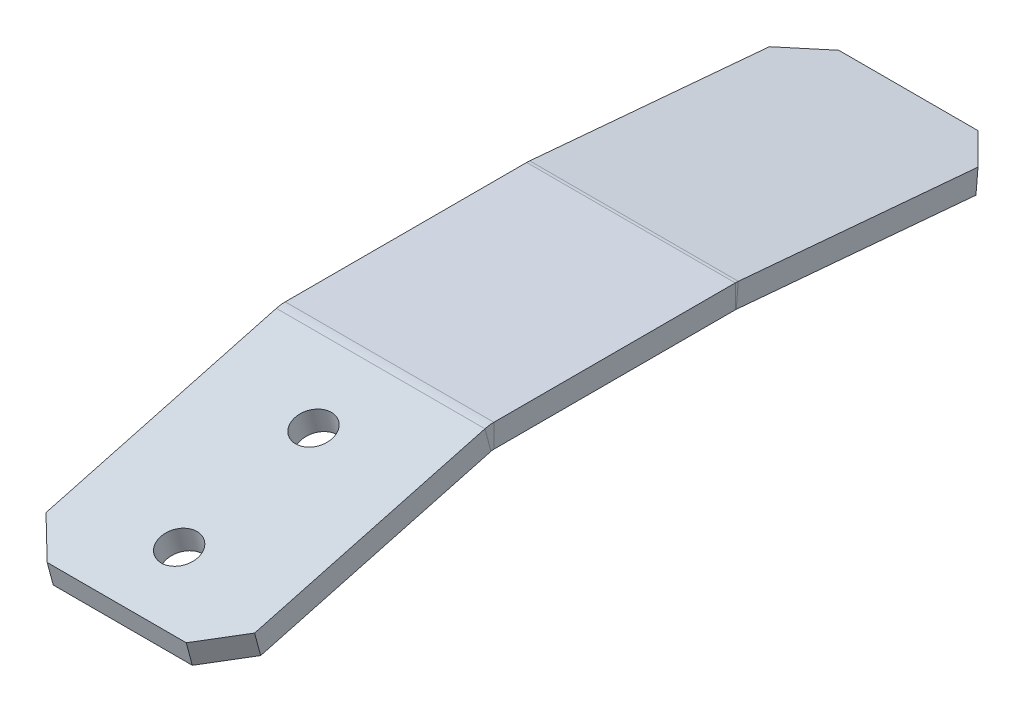
from build123d import *

# Parameters (mm, degrees)
SKETCH1_W                        = 38.1
SKETCH1_H                        = 44.45
BASE_FLANGE1_DEPTH               = 4.2672
EDGE_FLANGE1_STRIP_CUT_DEPTH     = 38.1
EDGE_FLANGE1_DEPTH               = 38.1
EDGE_FLANGE2_STRIP_CUT_DEPTH     = 38.1
EDGE_FLANGE2_DEPTH               = 38.1
CHAMFER1_SIZE                    = 6.35
F_17_64_0_26563_DIAMETER_HOLE1_D = 6.747002


# Sheet-metal steps are written as plain solids
with BuildPart() as part:
    # Sketch1 → Base-Flange1 (new body)
    with BuildSketch(Plane(origin=(0, 0, 0), x_dir=(1, 0, 0), z_dir=(0, 1, 0))):
        Rectangle(SKETCH1_W, SKETCH1_H)
    extrude(amount=-BASE_FLANGE1_DEPTH)

    # Edge-Flange1 strip (across the edge) → Edge-Flange1 strip cut (cut)
    with BuildSketch(Plane(origin=(19.05, -4.2672, 22.225), x_dir=(0, -0.96592582628907, -0.2588190451025146), z_dir=(-1, 0, 0))):
        Polygon((-9.522131081, 19.049882248), (-4.052559965, -1.362835054), (0.069238721, -0.258402425), (-5.400332395, 20.154314877), align=None)
    extrude(amount=EDGE_FLANGE1_STRIP_CUT_DEPTH, mode=Mode.SUBTRACT)

    # Edge-Flange1 section (across the edge) → Edge-Flange1 (add)
    with BuildSketch(Plane(origin=(19.05, -4.2672, 22.225), x_dir=(0, -0.96592582628907, -0.2588190451025146), z_dir=(-1, 0, 0))):
        with BuildLine():
            Line((-4.2672, 0.267517875), (-4.2672, 50.17300498))
            Line((-4.2672, 50.17300498), (0, 50.17300498))
            Line((0, 50.17300498), (0, 0.267517875))
            ThreePointArc((0, 0.267517875), (0.017384042, 0.002288653), (0.069238721, -0.258402425))
            Line((0.069238721, -0.258402425), (-4.052559965, -1.362835054))
            ThreePointArc((-4.052559965, -1.362835054), (-4.213309471, -0.554692715), (-4.2672, 0.267517875))
        make_face()
    extrude(amount=EDGE_FLANGE1_DEPTH)

    # Edge-Flange2 strip (across the edge) → Edge-Flange2 strip cut (cut)
    with BuildSketch(Plane(origin=(-19.05, -4.2672, -22.225), x_dir=(0, -0.9961946980917461, 0.08715574274765156), z_dir=(1, 0, 0))):
        Polygon((-6.085074523, 20.592090897), (-4.243229642, -0.460292419), (0.007732373, -0.088381433), (-1.834112507, 20.964001883), align=None)
    extrude(amount=EDGE_FLANGE2_STRIP_CUT_DEPTH, mode=Mode.SUBTRACT)

    # Edge-Flange2 section (across the edge) → Edge-Flange2 (add)
    with BuildSketch(Plane(origin=(-19.05, -4.2672, -22.225), x_dir=(0, -0.9961946980917461, 0.08715574274765156), z_dir=(1, 0, 0))):
        with BuildLine():
            Line((-4.2672, 0.088719036), (-4.2672, 50.38333524))
            Line((-4.2672, 50.38333524), (0, 50.38333524))
            Line((0, 50.38333524), (0, 0.088719036))
            ThreePointArc((0, 0.088719036), (0.001934014, 8.4441e-05), (0.007732373, -0.088381433))
            Line((0.007732373, -0.088381433), (-4.243229642, -0.460292419))
            ThreePointArc((-4.243229642, -0.460292419), (-4.261204557, -0.186048209), (-4.2672, 0.088719036))
        make_face()
    extrude(amount=EDGE_FLANGE2_DEPTH)

    # Chamfer1
    chamfer1_edges = [part.edges().sort_by_distance(p)[0] for p in [
        (19.05, -15.192029896, 71.240617608),
        (-19.05, -15.192029896, 71.240617608),
        (-19.05, -6.532915997, -72.602566931),
        (19.05, -6.532915997, -72.602566931),
    ]]
    chamfer(chamfer1_edges, length=CHAMFER1_SIZE)

    # 17/64 (0.26563) Diameter Hole1 (through all)
    with Locations(Plane(origin=(0, 5.696696884, 1.52642533), x_dir=(1, 0, 0), z_dir=(0, 0.9659258262890699, 0.25881904510251463))):
        with Locations((0, -35.539651994), (0, -60.939651994)):
            Hole(F_17_64_0_26563_DIAMETER_HOLE1_D / 2)


solid = part.part
